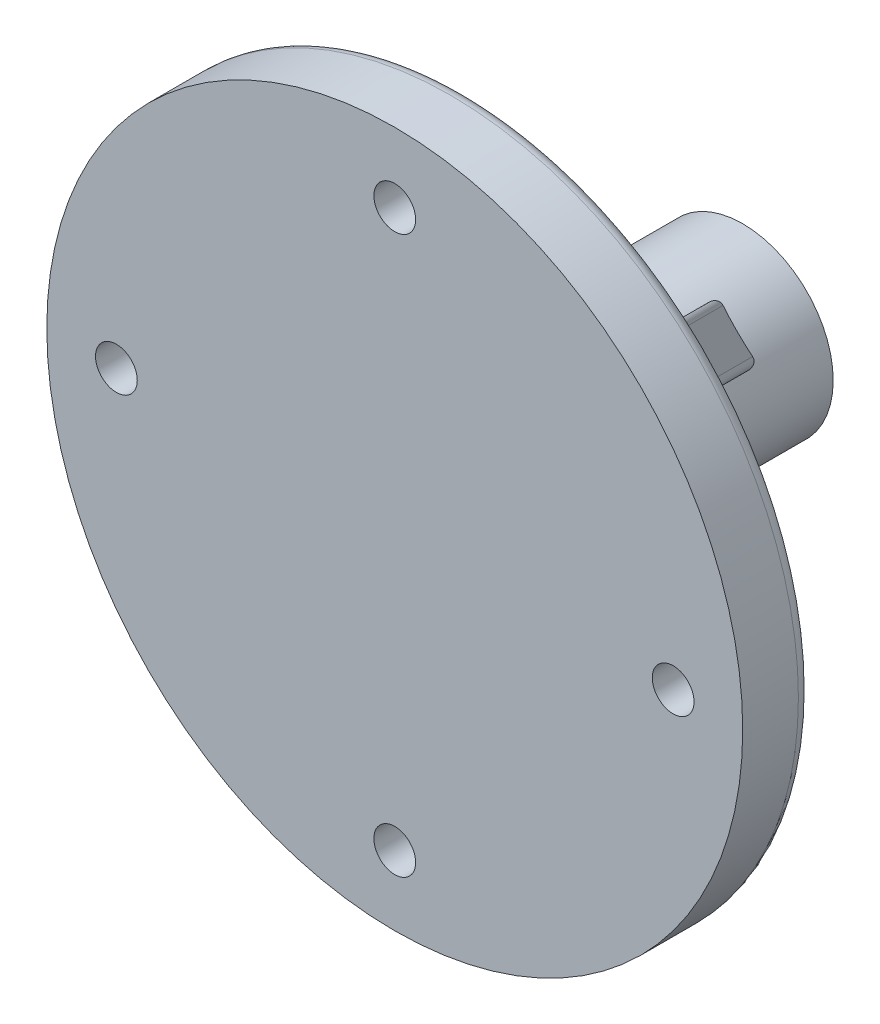
from build123d import *

# Parameters (mm, degrees)
SKETCH1_R           = 6.5
BOSS_EXTRUDE1_DEPTH = 20
SKETCH4_R           = 2.5
CUT_EXTRUDE1_DEPTH  = 15.5
FILLET1_R           = 1
SKETCH5_R           = 25
BOSS_EXTRUDE2_DEPTH = 5
CUT_EXTRUDE2_REACH  = 42.62
SKETCH6_R           = 1.5
FILLET2_R           = 5
RIB10_REACH         = 45.301
SKETCH12_WALL_W     = 109.815743814
SKETCH12_WALL_H     = 4
CIRPATTERN1_COUNT   = 4
FILLET3_R           = 1
FILLET4_R           = 0.5
SKETCH13_R          = 3
CUT_EXTRUDE3_DEPTH  = 1


with BuildPart() as part:
    # Sketch1 → Boss-Extrude1 (new body)
    with BuildSketch(Plane.XY):
        Circle(SKETCH1_R)
    extrude(amount=BOSS_EXTRUDE1_DEPTH)

    # Sketch4 → Cut-Extrude1 (cut)
    with BuildSketch(Plane(origin=(0, 0, 0), x_dir=(-1, 0, 0), z_dir=(0, 0, -1))):
        Circle(SKETCH4_R)
    extrude(amount=-CUT_EXTRUDE1_DEPTH, mode=Mode.SUBTRACT)

    # Fillet1
    fillet1_edges = [part.edges().sort_by_distance(p)[0] for p in [
        (2.5, 0, 15.5),
    ]]
    fillet(fillet1_edges, radius=FILLET1_R)

    # Sketch5 → Boss-Extrude2 (add)
    with BuildSketch(Plane.XY.offset(20)):
        Circle(SKETCH5_R)
    extrude(amount=BOSS_EXTRUDE2_DEPTH)

    # Sketch6 → Cut-Extrude2 (cut, up to next)
    with BuildSketch(Plane(origin=(0, 0, 20), x_dir=(-1, 0, 0), z_dir=(0, 0, -1)), mode=Mode.PRIVATE) as cut_extrude2_sk1:
        with Locations((0, 20)):
            Circle(SKETCH6_R)
    cut_extrude2_tool1 = extrude(cut_extrude2_sk1.sketch, amount=-CUT_EXTRUDE2_REACH, mode=Mode.PRIVATE) & part.part
    # Sketch6 → Cut-Extrude2 (cut, up to next)
    with BuildSketch(Plane(origin=(0, 0, 20), x_dir=(-1, 0, 0), z_dir=(0, 0, -1)), mode=Mode.PRIVATE) as cut_extrude2_sk2:
        with Locations((0, -20)):
            Circle(SKETCH6_R)
    cut_extrude2_tool2 = extrude(cut_extrude2_sk2.sketch, amount=-CUT_EXTRUDE2_REACH, mode=Mode.PRIVATE) & part.part
    # Sketch6 → Cut-Extrude2 (cut, up to next)
    with BuildSketch(Plane(origin=(0, 0, 20), x_dir=(-1, 0, 0), z_dir=(0, 0, -1)), mode=Mode.PRIVATE) as cut_extrude2_sk3:
        with Locations((-20, 0)):
            Circle(SKETCH6_R)
    cut_extrude2_tool3 = extrude(cut_extrude2_sk3.sketch, amount=-CUT_EXTRUDE2_REACH, mode=Mode.PRIVATE) & part.part
    # Sketch6 → Cut-Extrude2 (cut, up to next)
    with BuildSketch(Plane(origin=(0, 0, 20), x_dir=(-1, 0, 0), z_dir=(0, 0, -1)), mode=Mode.PRIVATE) as cut_extrude2_sk4:
        with Locations((20, 0)):
            Circle(SKETCH6_R)
    cut_extrude2_tool4 = extrude(cut_extrude2_sk4.sketch, amount=-CUT_EXTRUDE2_REACH, mode=Mode.PRIVATE) & part.part
    add(cut_extrude2_tool1.solids().sort_by_distance((0, 20, 20))[0], mode=Mode.SUBTRACT)
    add(cut_extrude2_tool2.solids().sort_by_distance((0, -20, 20))[0], mode=Mode.SUBTRACT)
    add(cut_extrude2_tool3.solids().sort_by_distance((20, 0, 20))[0], mode=Mode.SUBTRACT)
    add(cut_extrude2_tool4.solids().sort_by_distance((-20, 0, 20))[0], mode=Mode.SUBTRACT)

    # Fillet2
    fillet2_edges = [part.edges().sort_by_distance(p)[0] for p in [
        (-6.5, 0, 20),
    ]]
    fillet(fillet2_edges, radius=FILLET2_R)

    # Sketch12 wall → Rib10 (add, up to next)
    with BuildSketch(Plane(origin=(9.899494937, 9.899494937, 12.5), x_dir=(0.500000000005, 0.500000000005, 0.70710678118), z_dir=(0.499999999995, 0.499999999995, -0.707106781193)), mode=Mode.PRIVATE) as rib10_sk1:
        Rectangle(SKETCH12_WALL_W, SKETCH12_WALL_H)
    rib10_tool1 = extrude(rib10_sk1.sketch, amount=-RIB10_REACH, mode=Mode.PRIVATE) - part.part
    rib10 = rib10_tool1.solids().sort_by_distance((9.899494937, 9.899494937, 12.5))[0]
    add(rib10)

    # CirPattern1: Rib10 ×4 about axis
    cirpattern1_axis = Axis((0, 0, 20), (0, 0, 1))
    for i in range(1, CIRPATTERN1_COUNT):
        add(rib10.rotate(cirpattern1_axis, i * 360 / CIRPATTERN1_COUNT))

    # Fillet3
    fillet3_edges = [part.edges().sort_by_distance(p)[0] for p in [
        (-25, 0, 20),
    ]]
    fillet(fillet3_edges, radius=FILLET3_R)

    # Fillet4
    fillet4_edges = [part.edges().sort_by_distance(p)[0] for p in [
        (8.373791296, -11.202218421, 12.342329219),
        (11.202218421, -8.373791296, 12.342329219),
        (-8.373791296, -11.202218421, 12.342329219),
        (-11.202218421, -8.373791296, 12.342329219),
        (11.202218421, 8.373791296, 12.342329219),
        (8.373791296, 11.202218421, 12.342329219),
        (-11.202218421, 8.373791296, 12.342329219),
        (-8.373791296, 11.202218421, 12.342329219),
    ]]
    fillet(fillet4_edges, radius=FILLET4_R)

    # Sketch13 → Cut-Extrude3 (cut)
    with BuildSketch(Plane(origin=(0, 0, 20), x_dir=(-1, 0, 0), z_dir=(0, 0, -1))):
        with Locations((-20, 0)):
            Circle(SKETCH13_R)
        with Locations((0, 20)):
            Circle(SKETCH13_R)
        with Locations((20, 0)):
            Circle(SKETCH13_R)
        with Locations((0, -20)):
            Circle(SKETCH13_R)
    extrude(amount=-CUT_EXTRUDE3_DEPTH, mode=Mode.SUBTRACT)


solid = part.part
